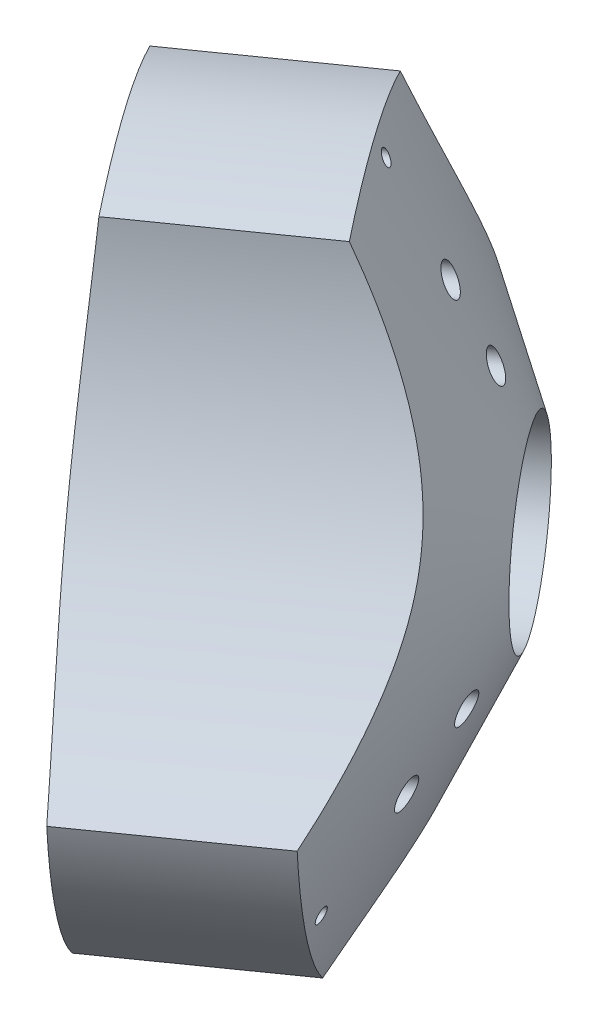
from build123d import *

# Parameters (mm, degrees)
SKETCH_2_R               = 1
SKETCH_2_R_2             = 2
SKETCH_2_R_3             = 65.999999996
SKETCH_2_R_4             = 66.000000001
SKETCH_2_R_5             = 66.000000003
SKETCH_2_R_6             = 12.5
CUT_EXTRUDE_1_DEPTH      = 70
FILLET_1_R               = 3.5
SHELL_1_T                = 2
SKETCH_4_W               = 34.54188511
SKETCH_4_H               = 3.058034095
SKETCH_4_W_2             = 39.934942898
SKETCH_4_H_2             = 2.351311785
EXTRUDE_1_DEPTH          = 0.5
PATTERN_CIRCULAR_1_COUNT = 3


with BuildPart() as part:
    # 草图1 → 旋转1 (revolve)
    with BuildSketch(Plane(origin=(0, 0, 0), x_dir=(1, 0, 0), z_dir=(0, 1, 0))):
        Polygon((78.914719336, -45.561433778), (43.903980814, -25.347974766), (23.111632832, -40.030522311), (41.541745977, -71.952414667), align=None)
    revolve(axis=Axis((88.4526384, 0, 51.068153835), (-0.8168642718459468, 0, 0.5768299241384683)))

    # 草图2 → 切除-拉伸1 (cut)
    with BuildSketch(Plane(origin=(-6.183938487, 0, 4.366797388), x_dir=(0.5768299241384683, 0, 0.8168642718459469), z_dir=(-0.8168642718459469, 0, 0.5768299241384683))):
        with Locations((92.737878995, 44.206894123)):
            Circle(SKETCH_2_R)
        with Locations((92.737878995, 30)):
            Circle(SKETCH_2_R_2)
        with Locations((92.737878995, 20)):
            Circle(SKETCH_2_R_2)
        with Locations((11.764503741, 46.75)):
            Circle(SKETCH_2_R_3)
        with Locations((173.711254249, 46.75)):
            Circle(SKETCH_2_R_4)
        with Locations((131.022172328, -22.103447061)):
            Circle(SKETCH_2_R)
        with Locations((118.718641109, -15)):
            Circle(SKETCH_2_R_2)
        with Locations((110.058387071, -10)):
            Circle(SKETCH_2_R_2)
        with Locations((92.737878995, -93.5)):
            Circle(SKETCH_2_R_5)
        with Locations((54.453585663, -22.103447061)):
            Circle(SKETCH_2_R)
        with Locations((66.757116882, -15)):
            Circle(SKETCH_2_R_2)
        with Locations((75.41737092, -10)):
            Circle(SKETCH_2_R_2)
        with Locations((92.737878995, 0)):
            Circle(SKETCH_2_R_6)
    extrude(amount=-CUT_EXTRUDE_1_DEPTH, mode=Mode.SUBTRACT)

    # 圆角1
    fillet_1_edges = [part.edges().sort_by_distance(p)[0] for p in [
        (47.496898524, 12.499999998, 79.989110645),
    ]]
    fillet(fillet_1_edges, radius=FILLET_1_R)

    # 抽壳1 (no face opened: a closed hollow body)
    add(offset(amount=-SHELL_1_T, mode=Mode.PRIVATE), mode=Mode.SUBTRACT)

    # 草图4 → 凸台-拉伸1 (add, symmetric)
    with BuildSketch(Plane(origin=(53.493983706, 0, 75.754259998), x_dir=(0.8168642718459468, 0, -0.5768299241384686), z_dir=(0.5768299241384685, 1.1118797194857233e-15, 0.8168642718459467))):
        with Locations((12.450975203, 24.939144455)):
            Rectangle(SKETCH_4_W, SKETCH_4_H)
        with Locations((14.556747511, 15.145392479)):
            Rectangle(SKETCH_4_W_2, SKETCH_4_H_2)
    extrude_1 = extrude(amount=EXTRUDE_1_DEPTH, both=True)

    # 阵列(圆周)1: 凸台-拉伸1 ×3 about axis
    pattern_circular_1_axis = Axis((72.723448322, 0, 62.175344873), (-0.8168642718459466, 0, 0.5768299241384688))
    for i in range(1, PATTERN_CIRCULAR_1_COUNT):
        add(extrude_1.rotate(pattern_circular_1_axis, i * 360 / PATTERN_CIRCULAR_1_COUNT))


solid = part.part
